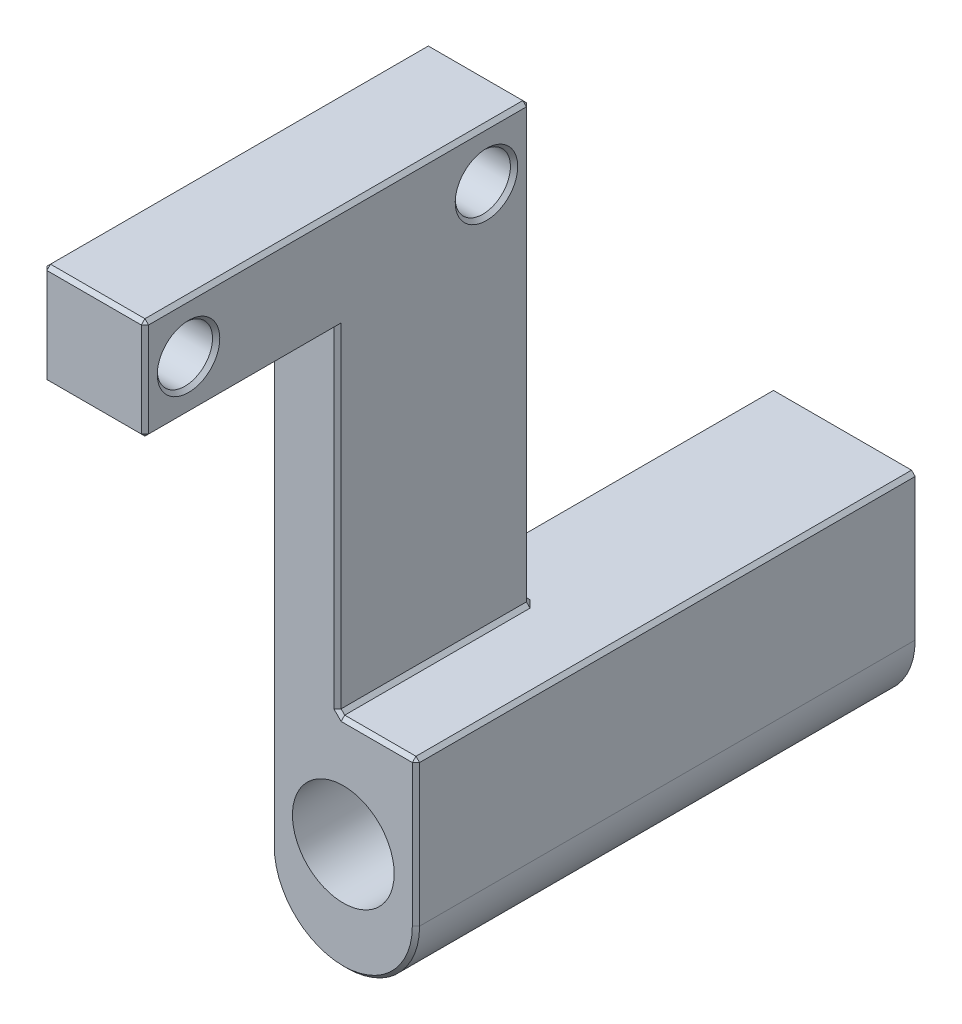
from build123d import *

# Parameters (mm, degrees)
BOSS_EXTRUDE1_DEPTH             = 26.5
SKETCH2_W                       = 10
SKETCH2_H                       = 15
BOSS_EXTRUDE2_DEPTH             = 21.1
BOSS_EXTRUDE2_DIRECTION_2_REACH = 46.455
SKETCH3_W                       = 13.25
SKETCH3_H                       = 38
CUT_EXTRUDE1_DEPTH              = 21.1
CUT_EXTRUDE2_DEPTH              = 46.618088518
CUT_EXTRUDE2_DEPTH_BACK         = 46.618088518
SKETCH4_R                       = 1.8
SKETCH5_R                       = 3.5
CUT_EXTRUDE3_DEPTH              = 11.1
SKETCH6_R                       = 1.9
CUT_EXTRUDE4_DEPTH              = 46.618088518
FILLET1_R                       = 5
CHAMFER1_SIZE                   = 0.25


with BuildPart() as part:
    # Sketch1 → Boss-Extrude1 (new body)
    with BuildSketch(Plane.XY):
        Polygon((0, 35), (0, 28), (2.4, 28), (2.4, -10), (7, -10), (7, 35), align=None)
    extrude(amount=BOSS_EXTRUDE1_DEPTH)

    # Sketch2 → Boss-Extrude2 (add)
    with BuildSketch(Plane.XY):
        with Locations((7.4, -2.5)):
            Rectangle(SKETCH2_W, SKETCH2_H)
    extrude(amount=-BOSS_EXTRUDE2_DEPTH)

    # Boss-Extrude2 direction 2: up to this face of the body (flat: up to its plane)
    boss_extrude2_direction_2_end = Plane(part.part.faces().sort_by_distance((4.437265416, 13.926273458, 26.5))[0])
    # Sketch2 → Boss-Extrude2 direction 2 (add, up to the picked face)
    with BuildSketch(Plane.XY, mode=Mode.PRIVATE) as boss_extrude2_direction_2_sk1:
        with Locations((7.4, -2.5)):
            Rectangle(SKETCH2_W, SKETCH2_H)
    boss_extrude2_direction_2_tool1 = split(extrude(boss_extrude2_direction_2_sk1.sketch, amount=BOSS_EXTRUDE2_DIRECTION_2_REACH, mode=Mode.PRIVATE), bisect_by=boss_extrude2_direction_2_end, keep=Keep.BOTH, mode=Mode.PRIVATE)
    add(boss_extrude2_direction_2_tool1.solids().sort_by(Axis((7.4, -2.5, 0), (0, 0, 1)))[0])

    # Sketch3 → Cut-Extrude1 (cut)
    with BuildSketch(Plane(origin=(0, 0, 0), x_dir=(0, 0, -1), z_dir=(1, 0, 0))):
        with Locations((-19.875, 9)):
            Rectangle(SKETCH3_W, SKETCH3_H)
    extrude(amount=CUT_EXTRUDE1_DEPTH, mode=Mode.SUBTRACT)

    # Sketch4 → Cut-Extrude2 (cut, two sides: drawn at the far end of the back side and taken through both)
    with BuildSketch(Plane.XY.offset(-CUT_EXTRUDE2_DEPTH_BACK)):
        with Locations((7.4, -2.5)):
            Circle(SKETCH4_R)
    extrude(amount=CUT_EXTRUDE2_DEPTH + CUT_EXTRUDE2_DEPTH_BACK, mode=Mode.SUBTRACT)

    # Sketch5 → Cut-Extrude3 (cut)
    with BuildSketch(Plane.XY.offset(13.25)):
        with Locations((7.4, -2.5)):
            Circle(SKETCH5_R)
    extrude(amount=-CUT_EXTRUDE3_DEPTH, mode=Mode.SUBTRACT)

    # Sketch6 → Cut-Extrude4 (cut, through all)
    with BuildSketch(Plane(origin=(0, 0, 0), x_dir=(0, 0, -1), z_dir=(1, 0, 0))):
        with Locations(Location((-3, 31.5, 0), (0, 0, 270))):
            Circle(SKETCH6_R)
        with Locations(Location((-23.5, 31.5, 0), (0, 0, 180))):
            Circle(SKETCH6_R)
    extrude(amount=CUT_EXTRUDE4_DEPTH, mode=Mode.SUBTRACT)

    # Fillet1
    fillet1_edges = [part.edges().sort_by_distance(p)[0] for p in [
        (2.4, -10, -3.925),
        (12.4, -10, -3.925),
    ]]
    fillet(fillet1_edges, radius=FILLET1_R - 0.0001)  # a hair under: the kernel refuses the full size

    # Chamfer1
    chamfer1_edges = [part.edges().sort_by_distance(p)[0] for p in [
        (3.864436805, -8.535563195, 13.25),
        (10.935563195, -8.535563195, 13.25),
        (7, 35, 13.25),
        (0, 28, 13.25),
        (0, 35, 13.25),
        (3.5, 28, 26.5),
        (7, 20, 0),
        (4.7, 5, 0),
        (2.4, 5, -10.55),
        (7, 5, 6.625),
        (12.4, 5, -3.925),
        (7, 31.5, 26.5),
        (7, 28, 19.875),
        (2.4, 11.49995, 13.25),
        (9.7, 5, 13.25),
        (7, 16.5, 13.25),
        (3.5, 35, 26.5),
        (2.4, 16.5, 0),
        (1.2, 28, 0),
        (0, 33.4, 3),
        (7, 33.4, 3),
        (0, 31.5, 21.6),
        (7, 31.5, 21.6),
        (0, 31.5, 0),
        (3.5, 35, 0),
        (0, 31.5, 26.5),
        (12.4, -5e-05, 13.25),
    ]]
    chamfer(chamfer1_edges, length=CHAMFER1_SIZE)


solid = part.part
